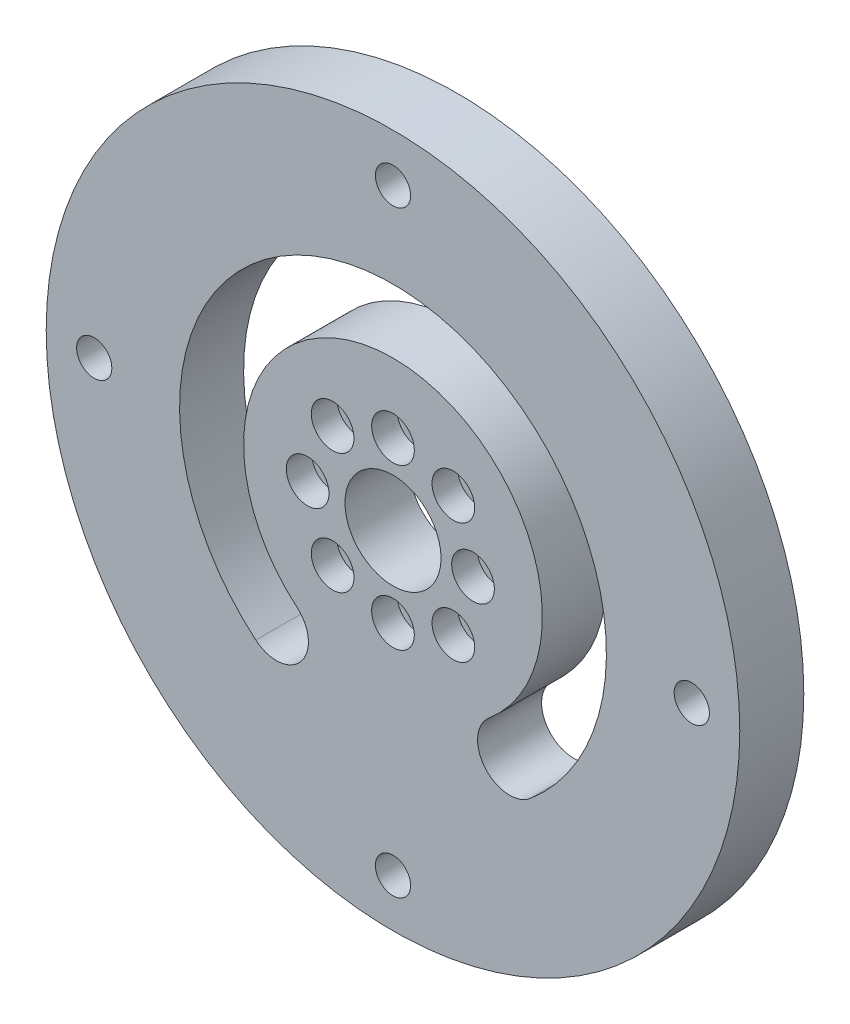
from build123d import *

# Parameters (mm, degrees)
SKETCH1_R           = 32.5
BOSS_EXTRUDE1_DEPTH = 6
SKETCH16_R          = 1
CUT_EXTRUDE8_DEPTH  = 47.351914739
SKETCH17_R          = 2
CUT_EXTRUDE9_DEPTH  = 2.4
SKETCH18_R          = 4.5
CUT_EXTRUDE10_DEPTH = 47.351914739
SKETCH19_R          = 1.65
CUT_EXTRUDE11_DEPTH = 10
CUT_EXTRUDE12_DEPTH = 3
CUT_EXTRUDE13_DEPTH = 47.351914739


with BuildPart() as part:
    # Sketch1 → Boss-Extrude1 (new body)
    with BuildSketch(Plane.XY):
        Circle(SKETCH1_R)
    extrude(amount=BOSS_EXTRUDE1_DEPTH)

    # Sketch16 → Cut-Extrude8 (cut, through all)
    with BuildSketch(Plane.XY.offset(6)):
        with Locations((-8, 0)):
            Circle(SKETCH16_R)
        with Locations((-5.656854249, 5.656854249)):
            Circle(SKETCH16_R)
        with Locations((0, 8)):
            Circle(SKETCH16_R)
        with Locations((5.656854249, 5.656854249)):
            Circle(SKETCH16_R)
        with Locations((8, 0)):
            Circle(SKETCH16_R)
        with Locations((5.656854249, -5.656854249)):
            Circle(SKETCH16_R)
        with Locations((0, -8)):
            Circle(SKETCH16_R)
        with Locations((-5.656854249, -5.656854249)):
            Circle(SKETCH16_R)
    extrude(amount=-CUT_EXTRUDE8_DEPTH, mode=Mode.SUBTRACT)

    # Sketch17 → Cut-Extrude9 (cut)
    with BuildSketch(Plane.XY.offset(6)):
        with Locations((7.5, 0)):
            Circle(SKETCH17_R)
        with Locations((-8, 0)):
            Circle(SKETCH17_R)
        with Locations((0, -7.5)):
            Circle(SKETCH17_R)
        with Locations((0, 7.5)):
            Circle(SKETCH17_R)
        with Locations((-5.656854249, 5.656854249)):
            Circle(SKETCH17_R)
        with Locations((5.656854249, 5.656854249)):
            Circle(SKETCH17_R)
        with Locations((5.656854249, -5.656854249)):
            Circle(SKETCH17_R)
        with Locations((-5.656854249, -5.656854249)):
            Circle(SKETCH17_R)
    extrude(amount=-CUT_EXTRUDE9_DEPTH, mode=Mode.SUBTRACT)

    # Sketch18 → Cut-Extrude10 (cut, through all)
    with BuildSketch(Plane(origin=(0, 0, 0), x_dir=(-1, 0, 0), z_dir=(0, 0, -1))):
        Circle(SKETCH18_R)
    extrude(amount=-CUT_EXTRUDE10_DEPTH, mode=Mode.SUBTRACT)

    # Sketch19 → Cut-Extrude11 (cut)
    with BuildSketch(Plane.XY.offset(6)):
        with Locations((0, 28)):
            Circle(SKETCH19_R)
        with Locations((28, 0)):
            Circle(SKETCH19_R)
        with Locations((0, -28)):
            Circle(SKETCH19_R)
        with Locations((-28, 0)):
            Circle(SKETCH19_R)
    extrude(amount=-CUT_EXTRUDE11_DEPTH, mode=Mode.SUBTRACT)

    # Sketch20 → Cut-Extrude12 (cut)
    with BuildSketch(Plane(origin=(0, 0, 0), x_dir=(-1, 0, 0), z_dir=(0, 0, -1))):
        Polygon((1.616580754, 30.8), (-1.616580754, 30.8), (-3.233161507, 28), (-1.616580754, 25.2), (1.616580754, 25.2), (3.233161507, 28), align=None)
        Polygon((29.616580754, 2.8), (26.383419246, 2.8), (24.766838493, 0), (26.383419246, -2.8), (29.616580754, -2.8), (31.233161507, 0), align=None)
        Polygon((1.616580754, -25.2), (-1.616580754, -25.2), (-3.233161507, -28), (-1.616580754, -30.8), (1.616580754, -30.8), (3.233161507, -28), align=None)
        Polygon((-26.383419246, 2.8), (-29.616580754, 2.8), (-31.233161507, 0), (-29.616580754, -2.8), (-26.383419246, -2.8), (-24.766838493, 0), align=None)
    extrude(amount=-CUT_EXTRUDE12_DEPTH, mode=Mode.SUBTRACT)

    # Sketch21 → Cut-Extrude13 (cut, through all)
    with BuildSketch(Plane.XY.offset(6)):
        with BuildLine():
            ThreePointArc((12.855752194, -15.320888862), (0, 20), (-12.855752194, -15.320888862))
            ThreePointArc((-12.855752194, -15.320888862), (-8.629256035, -14.951118362), (-8.999026536, -10.724622204))
            ThreePointArc((-8.999026536, -10.724622204), (0, 14), (8.999026536, -10.724622204))
            ThreePointArc((8.999026536, -10.724622204), (8.629256035, -14.951118362), (12.855752194, -15.320888862))
        make_face()
    extrude(amount=-CUT_EXTRUDE13_DEPTH, mode=Mode.SUBTRACT)


solid = part.part
